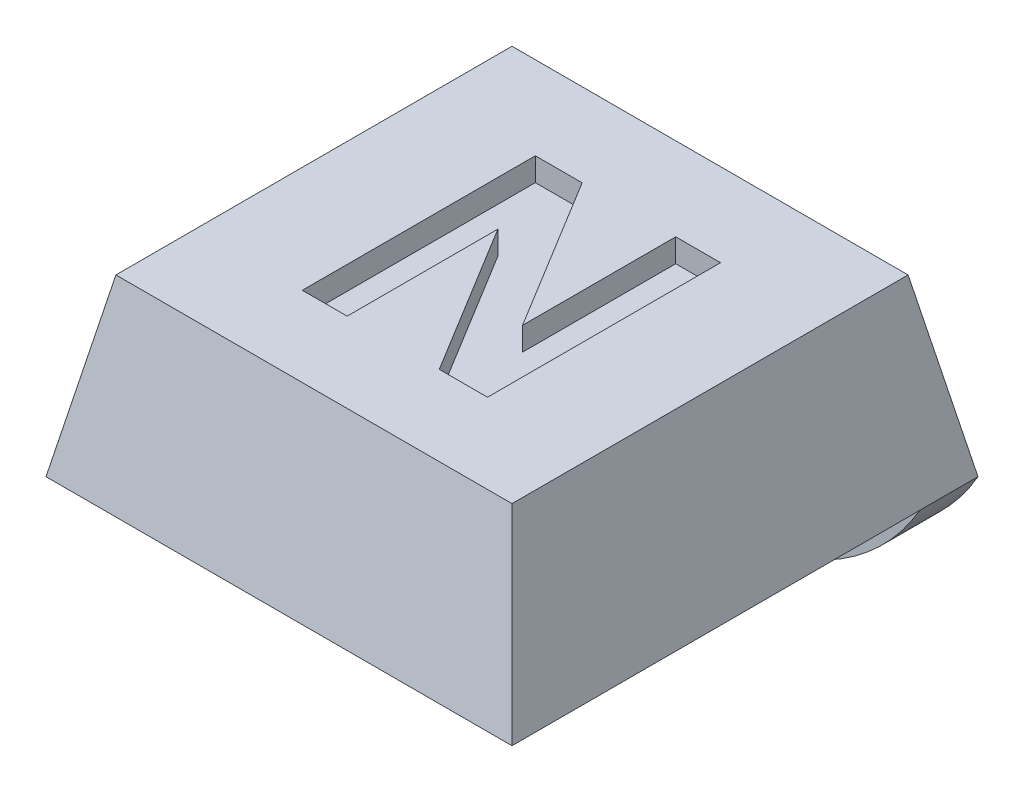
from build123d import *

# Parameters (mm, degrees)
SKETCH1_W               = 8
SKETCH1_H               = 8
BOSS_EXTRUDE1_DEPTH     = 3
CUT_EXTRUDE1_DEPTH      = 12.704699911
CUT_EXTRUDE1_DEPTH_BACK = 12.704699911
CUT_EXTRUDE2_DEPTH      = 11
SKETCH4_R               = 1.8
CUT_EXTRUDE3_DEPTH      = 0.8
SKETCH5_W               = 8
SKETCH5_H               = 1
BOSS_EXTRUDE2_DEPTH     = 2
FILLET1_R               = 4
CUT_EXTRUDE4_DEPTH      = 0.4


with BuildPart() as part:
    # Sketch1 → Boss-Extrude1 (new body)
    with BuildSketch(Plane(origin=(0, 0, 0), x_dir=(1, 0, 0), z_dir=(0, 1, 0))):
        with Locations((4, 4)):
            Rectangle(SKETCH1_W, SKETCH1_H)
    extrude(amount=BOSS_EXTRUDE1_DEPTH)

    # Sketch2 → Cut-Extrude1 (cut, two sides: drawn at the far end of the back side and taken through both)
    with BuildSketch(Plane.XY.offset(-CUT_EXTRUDE1_DEPTH_BACK)):
        Polygon((0, 0), (0.6, 3), (0, 3), align=None)
        Polygon((8, 0), (7.4, 3), (8, 3), align=None)
    extrude(amount=CUT_EXTRUDE1_DEPTH + CUT_EXTRUDE1_DEPTH_BACK, mode=Mode.SUBTRACT)

    # Sketch3 → Cut-Extrude2 (cut)
    with BuildSketch(Plane(origin=(0, 0, 0), x_dir=(0, 0, -1), z_dir=(1, 0, 0))):
        Polygon((0, 0), (0.6, 3), (0, 3), align=None)
        Polygon((8, 3), (7.4, 3), (8, 0), align=None)
    extrude(amount=CUT_EXTRUDE2_DEPTH, mode=Mode.SUBTRACT)

    # Sketch4 → Cut-Extrude3 (cut)
    with BuildSketch(Plane.XZ):
        with Locations(Location((4, -3.75, 0), (0, 0, 270))):
            Circle(SKETCH4_R)
    extrude(amount=-CUT_EXTRUDE3_DEPTH, mode=Mode.SUBTRACT)

    # Sketch5 → Boss-Extrude2 (add)
    with BuildSketch(Plane.XZ):
        with Locations((4, -7.5)):
            Rectangle(SKETCH5_W, SKETCH5_H)
    extrude(amount=BOSS_EXTRUDE2_DEPTH)

    # Fillet1
    # the kernel refuses this fillet: 4 mm, written as the material it takes off along each edge
    with BuildSketch(Plane(origin=(8, -2, -16.660254038), x_dir=(0, 1, 0), z_dir=(0, 0, 1)), Plane(origin=(0, -2, 1.660254038), x_dir=(0, 1, 0), z_dir=(0, 0, -1))) as fillet1_piece_1:
        with BuildLine():
            CenterArc((4, 3.464101615), FILLET1_R, 180, 60)
            Line((0, 3.464101615), (-0.08, 3.464101615))
            Line((-0.08, 3.464101615), (-0.08, 0))
            Line((-0.08, 0), (0, -0.08))
            ThreePointArc((0, -0.08), (1, -0.08), (1.96, -0.069282032))
            Line((1.96, -0.069282032), (2, 0))
        make_face()
    extrude(amount=18.320508076, mode=Mode.SUBTRACT)

    # Sketch6 → Cut-Extrude4 (cut)
    with BuildSketch(Plane(origin=(0, 3, 0), x_dir=(1, 0, 0), z_dir=(0, 1, 0))):
        Polygon((2.428562008, 1.972012859), (2.428562008, 5.972012859), (3.232247906, 5.972012859), (4.838818418, 3.342205167), (4.838818418, 5.972012859), (5.608049188, 5.972012859), (5.608049188, 1.972012859), (4.779523547, 1.972012859), (3.197792777, 4.560153885), (3.197792777, 1.972012859), align=None)
    extrude(amount=-CUT_EXTRUDE4_DEPTH, mode=Mode.SUBTRACT)


solid = part.part
